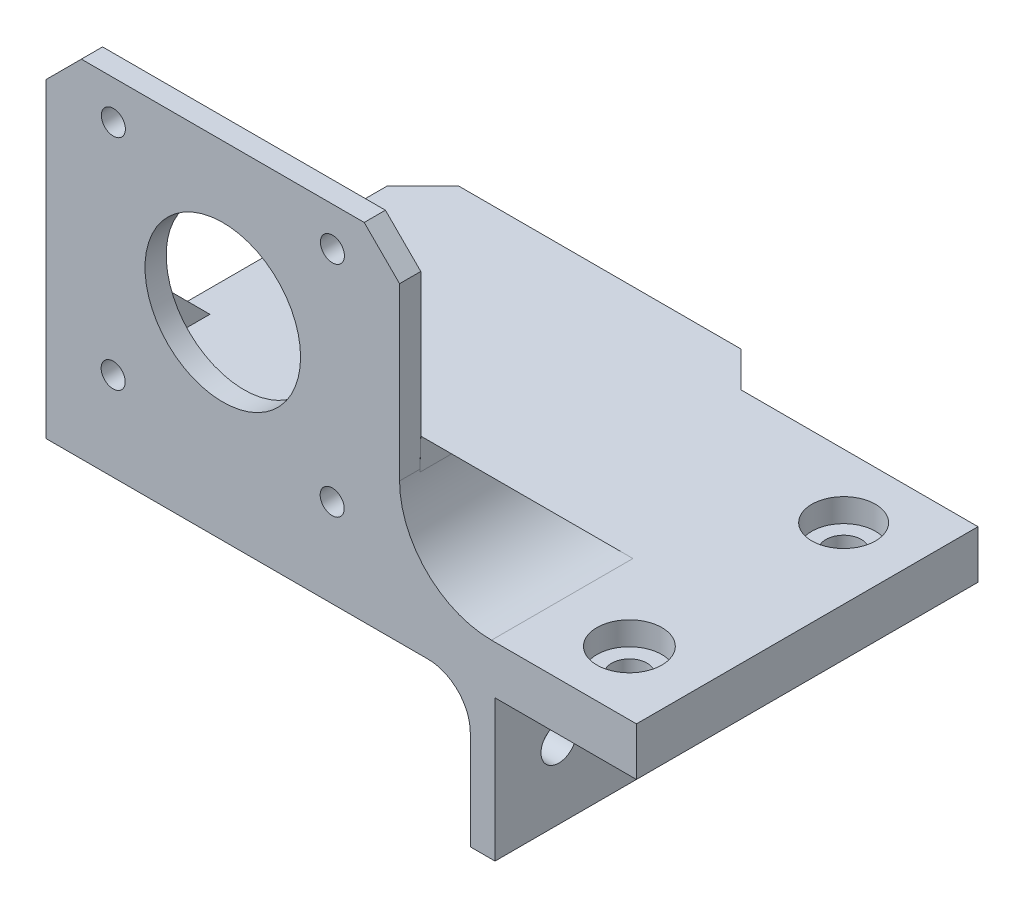
from build123d import *

# Parameters (mm, degrees)
SKETCH1_W               = 50
SKETCH1_H               = 53.3
BOSS_EXTRUDE1_DEPTH     = 3.175
SKETCH2_W               = 50
SKETCH2_H               = 3
BOSS_EXTRUDE2_DEPTH     = 48.97
SKETCH3_W               = 3.175
SKETCH3_H               = 15
SKETCH3_H_2             = 15.175
BOSS_EXTRUDE3_DEPTH     = 20
CUT_EXTRUDE1_DEPTH      = 65
SKETCH5_R               = 11
SKETCH5_R_2             = 1.7
CUT_EXTRUDE2_DEPTH      = 65
CUT_EXTRUDE3_DEPTH      = 65
CHAMFER1_SIZE           = 5
FILLET1_R               = 5
BOSS_EXTRU_1_DEPTH      = 6.81
ENL_V_MAT_EXTRU_1_DEPTH = 6.81
BOSS_EXTRU_2_DEPTH      = 3.18
BOSS_EXTRU_3_DEPTH      = 3.18
ESQUISSE5_W             = 13.5
ESQUISSE5_H             = 48.3
BOSS_EXTRU_4_DEPTH      = 6.81
ESQUISSE6_W             = 20
ESQUISSE6_H             = 48.3
ESQUISSE6_R             = 2.5
BOSS_EXTRU_5_DEPTH      = 6.81
ESQUISSE7_W             = 3.5
ESQUISSE7_H             = 48.3
BOSS_EXTRU_6_DEPTH      = 20
ESQUISSE8_R             = 2.5
ENL_V_MAT_EXTRU_2_DEPTH = 10
ESQUISSE9_R             = 4.5
ESQUISSE9_R_2           = 4.595775112
ENL_V_MAT_EXTRU_3_DEPTH = 3.31
CONG_1_R                = 6
CONG_2_R                = 13
BOSS_EXTRU_7_DEPTH      = 3
BOSS_EXTRU_7_DEPTH_BACK = 3


with BuildPart() as part:
    # Sketch1 → Boss-Extrude1 (new body)
    with BuildSketch(Plane(origin=(0, 0, 0), x_dir=(1, 0, 0), z_dir=(0, 1, 0))):
        with Locations((25, 26.65)):
            Rectangle(SKETCH1_W, SKETCH1_H)
    extrude(amount=BOSS_EXTRUDE1_DEPTH)

    # Sketch2 → Boss-Extrude2 (add)
    with BuildSketch(Plane(origin=(0, 3.175, 0), x_dir=(1, 0, 0), z_dir=(0, 1, 0))):
        with Locations((25, 1.5)):
            Rectangle(SKETCH2_W, SKETCH2_H)
    extrude(amount=BOSS_EXTRUDE2_DEPTH)

    # Sketch3 → Boss-Extrude3 (add)
    with BuildSketch(Plane(origin=(0, 3.175, 0), x_dir=(1, 0, 0), z_dir=(0, 1, 0))):
        with Locations((1.5875, 10.5)):
            Rectangle(SKETCH3_W, SKETCH3_H)
        with Locations((48.4125, 10.5875)):
            Rectangle(SKETCH3_W, SKETCH3_H_2)
    extrude(amount=BOSS_EXTRUDE3_DEPTH)

    # Sketch4 → Cut-Extrude1 (cut)
    with BuildSketch(Plane(origin=(50, 0, 0), x_dir=(0, 0, -1), z_dir=(1, 0, 0))):
        Polygon((18.175, 3.175), (3, 23.175), (18.175, 23.175), align=None)
    extrude(amount=-CUT_EXTRUDE1_DEPTH, mode=Mode.SUBTRACT)

    # Sketch5 → Cut-Extrude2 (cut)
    with BuildSketch(Plane.XY):
        with Locations((25, 31.145)):
            Circle(SKETCH5_R)
        with Locations((40.502, 46.647)):
            Circle(SKETCH5_R_2)
        with Locations((9.528, 46.677)):
            Circle(SKETCH5_R_2)
        with Locations((9.498, 15.703)):
            Circle(SKETCH5_R_2)
        with Locations((40.472, 15.673)):
            Circle(SKETCH5_R_2)
    extrude(amount=-CUT_EXTRUDE2_DEPTH, mode=Mode.SUBTRACT)

    # Sketch6 → Cut-Extrude3 (cut)
    with BuildSketch(Plane(origin=(0, 3.175, 0), x_dir=(1, 0, 0), z_dir=(0, 1, 0))):
        with BuildLine():
            ThreePointArc((42.125, 42.3), (40, 44.425), (37.875, 42.3))
            Line((37.875, 42.3), (37.875, 12.3))
            ThreePointArc((37.875, 12.3), (40, 10.175), (42.125, 12.3))
            Line((42.125, 12.3), (42.125, 42.3))
        make_face()
        with BuildLine():
            Line((7.875, 42.3), (7.875, 12.3))
            ThreePointArc((7.875, 12.3), (10, 10.175), (12.125, 12.3))
            Line((12.125, 12.3), (12.125, 42.3))
            ThreePointArc((12.125, 42.3), (10, 44.425), (7.875, 42.3))
        make_face()
    extrude(amount=-CUT_EXTRUDE3_DEPTH, mode=Mode.SUBTRACT)

    # Chamfer1
    chamfer1_edges = [part.edges().sort_by_distance(p)[0] for p in [
        (0, 1.5875, -53.3),
        (50, 1.5875, -53.3),
        (0, 52.145, -1.5),
        (50, 52.145, -1.5),
    ]]
    chamfer(chamfer1_edges, length=CHAMFER1_SIZE)

    # Fillet1
    fillet1_edges = [part.edges().sort_by_distance(p)[0] for p in [
        (25, 3.175, -3),
        (25, 0, 0),
    ]]
    fillet(fillet1_edges, radius=FILLET1_R)

    # Esquisse2 → Boss.-Extru.1 (add)
    with BuildSketch(Plane(origin=(0, 3.175, 0), x_dir=(1, 0, 0), z_dir=(0, 1, 0))):
        Polygon((0, 48.3), (5, 53.3), (45, 53.3), (50, 48.3), (50, 0), (0, 0), align=None)
    extrude(amount=BOSS_EXTRU_1_DEPTH)

    # Esquisse2<2> → Enlèv. mat.-Extru.1 (cut)
    with BuildSketch(Plane(origin=(0, 3.175, 0), x_dir=(1, 0, 0), z_dir=(0, 1, 0))):
        Polygon((0, 48.3), (5, 53.3), (45, 53.3), (50, 48.3), (50, 0), (0, 0), align=None)
    extrude(amount=-ENL_V_MAT_EXTRU_1_DEPTH, mode=Mode.SUBTRACT)

    # Esquisse3 → Boss.-Extru.2 (add)
    with BuildSketch(Plane.ZY):
        Polygon((-20, 9.985), (-3, 26.985), (-3, 9.985), align=None)
    extrude(amount=-BOSS_EXTRU_2_DEPTH)

    # Esquisse4 → Boss.-Extru.3 (add)
    with BuildSketch(Plane.ZY.offset(-46.825)):
        Polygon((-20, 9.985), (-2.507234201, 9.985), (-3, 26.985), align=None)
    extrude(amount=-BOSS_EXTRU_3_DEPTH)

    # Esquisse5 → Boss.-Extru.4 (add)
    with BuildSketch(Plane(origin=(0, 9.985, 0), x_dir=(1, 0, 0), z_dir=(0, 1, 0))):
        with Locations((56.75, 24.15)):
            Rectangle(ESQUISSE5_W, ESQUISSE5_H)
    extrude(amount=-BOSS_EXTRU_4_DEPTH)

    # Esquisse6 → Boss.-Extru.5 (add)
    with BuildSketch(Plane(origin=(0, 9.985, 0), x_dir=(1, 0, 0), z_dir=(0, 1, 0))):
        with Locations((73.5, 24.15)):
            Rectangle(ESQUISSE6_W, ESQUISSE6_H)
        with Locations(Location((73.5, 39.3, 0), (0, 0, 270))):
            Circle(ESQUISSE6_R, mode=Mode.SUBTRACT)
        with Locations(Location((73.5, 9, 0), (0, 0, 270))):
            Circle(ESQUISSE6_R, mode=Mode.SUBTRACT)
    extrude(amount=-BOSS_EXTRU_5_DEPTH)

    # Esquisse7 → Boss.-Extru.6 (add)
    with BuildSketch(Plane(origin=(0, 3.175, 0), x_dir=(-1, 0, 0), z_dir=(0, -1, 0))):
        with Locations((-61.75, 24.15)):
            Rectangle(ESQUISSE7_W, ESQUISSE7_H)
    extrude(amount=BOSS_EXTRU_6_DEPTH)

    # Esquisse8 → Enlèv. mat.-Extru.2 (cut)
    with BuildSketch(Plane(origin=(63.5, 0, 0), x_dir=(0, 0, -1), z_dir=(1, 0, 0))):
        with Locations((9, -6.825)):
            Circle(ESQUISSE8_R)
        with Locations((39.3, -6.825)):
            Circle(ESQUISSE8_R)
    extrude(amount=-ENL_V_MAT_EXTRU_2_DEPTH, mode=Mode.SUBTRACT)

    # Esquisse9 → Enlèv. mat.-Extru.3 (cut)
    with BuildSketch(Plane(origin=(0, 9.985, 0), x_dir=(1, 0, 0), z_dir=(0, 1, 0))):
        with Locations(Location((73.5, 39.3, 0), (0, 0, 270))):
            Circle(ESQUISSE9_R)
        with Locations(Location((73.5, 9, 0), (0, 0, 270))):
            Circle(ESQUISSE9_R_2)
    extrude(amount=-ENL_V_MAT_EXTRU_3_DEPTH, mode=Mode.SUBTRACT)

    # Congé1
    cong_1_edges = [part.edges().sort_by_distance(p)[0] for p in [
        (60, 3.175, -24.15),
    ]]
    fillet(cong_1_edges, radius=CONG_1_R)

    # Congé2
    # the kernel refuses this fillet: 13 mm, written as the material it adds along each edge
    with BuildSketch(Plane(origin=(50, 9.985, 0), x_dir=(1, 0, 0), z_dir=(0, 0, -1))) as cong_2_piece_1_section:
        with BuildLine():
            CenterArc((CONG_2_R, -CONG_2_R), CONG_2_R, 90, 90)
            Line((0, -CONG_2_R), (0, 0))
            Line((0, 0), (CONG_2_R, 0))
        make_face()
    cong_2_piece_1 = extrude(amount=35.007234201, mode=Mode.PRIVATE)
    cong_2_piece_1 = split(cong_2_piece_1, bisect_by=Plane(origin=(52.869924632, 20.818582146, -9.166417854), z_dir=(0, -0.7071067811865461, 0.707106781186549)), keep=Keep.TOP, mode=Mode.PRIVATE)
    add(cong_2_piece_1)

    # Esquisse11 → Boss.-Extru.7 (add, two sides: drawn at the far end of the back side and taken through both)
    with BuildSketch(Plane(origin=(0, 0, -24.15), x_dir=(-1, 0, 0), z_dir=(0, 0, -1)).offset(-BOSS_EXTRU_7_DEPTH_BACK)):
        Polygon((-63.5, -16.825), (0, 9.985), (-63.5, 9.985), align=None)
    extrude(amount=BOSS_EXTRU_7_DEPTH + BOSS_EXTRU_7_DEPTH_BACK)


solid = part.part
